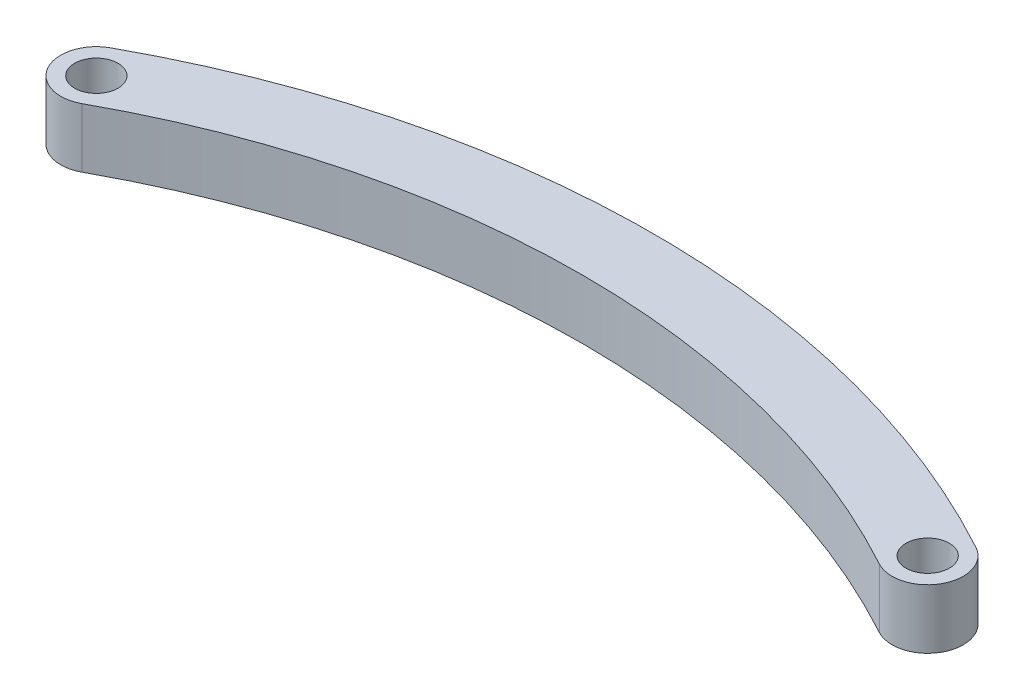
from build123d import *

# Parameters (mm, degrees)
ESQUISSE1_R        = 1.825
BOSS_EXTRU_1_DEPTH = 5


with BuildPart() as part:
    # Esquisse1 → Boss.-Extru.1 (new body)
    with BuildSketch(Plane(origin=(0, 0, 0), x_dir=(1, 0, 0), z_dir=(0, 1, 0))):
        with BuildLine():
            ThreePointArc((-36.438356038, 2.632704296), (-37.632704242, -1.438356135), (-33.561643767, -2.632704189))
            ThreePointArc((-33.561643767, -2.632704189), (6.8e-08, 5.937530488), (33.561643886, -2.632704254))
            ThreePointArc((33.561643886, -2.632704254), (37.632704286, -1.438356055), (36.438355996, 2.632704318))
            ThreePointArc((36.438355996, 2.632704318), (-2.4e-08, 11.937530488), (-36.438356038, 2.632704296))
        make_face()
        with Locations((-35, 0)):
            Circle(ESQUISSE1_R, mode=Mode.SUBTRACT)
        with Locations((35, 0)):
            Circle(ESQUISSE1_R, mode=Mode.SUBTRACT)
    extrude(amount=BOSS_EXTRU_1_DEPTH)


solid = part.part
